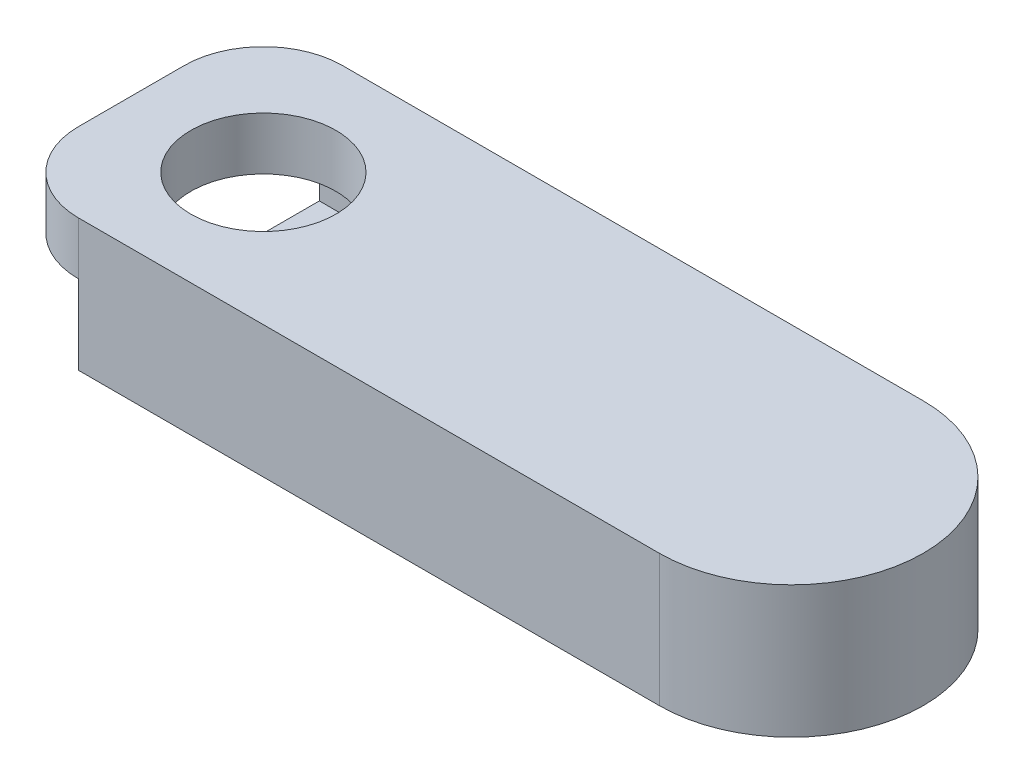
from build123d import *

# Parameters (mm, degrees)
SKETCH1_W           = 381
SKETCH1_H           = 127
BOSS_EXTRUDE1_DEPTH = 25.4
FILLET1_R           = 63.5
FILLET2_R           = 38.1
BOSS_EXTRUDE2_DEPTH = 25.4
BOSS_EXTRUDE3_DEPTH = 12.7
SKETCH11_R          = 34.925
CUT_EXTRUDE4_DEPTH  = 38.1


with BuildPart() as part:
    # Sketch1 → Boss-Extrude1 (new body)
    with BuildSketch(Plane(origin=(0, 0, 0), x_dir=(1, 0, 0), z_dir=(0, 1, 0))):
        with Locations((-190.5, -63.5)):
            Rectangle(SKETCH1_W, SKETCH1_H)
    extrude(amount=BOSS_EXTRUDE1_DEPTH)

    # Fillet1
    fillet1_edges = [part.edges().sort_by_distance(p)[0] for p in [
        (0, 12.7, 0),
        (0, 12.7, 127),
    ]]
    fillet(fillet1_edges, radius=FILLET1_R - 0.0001)  # a hair under: the kernel refuses the full size

    # Fillet2
    fillet2_edges = [part.edges().sort_by_distance(p)[0] for p in [
        (-381, 12.7, 127),
        (-381, 12.7, 0),
    ]]
    fillet(fillet2_edges, radius=FILLET2_R)

    # Sketch2 → Boss-Extrude2 (add)
    with BuildSketch(Plane(origin=(0, 0, 0), x_dir=(1, 0, 0), z_dir=(0, 1, 0))):
        with BuildLine():
            Line((-63.5, -12.7), (-342.9, -11.159231637))
            Line((-342.9, -11.159231637), (-342.9, 0))
            Line((-342.9, 0), (-63.5, 0))
            ThreePointArc((-63.5, 0), (0, -63.5), (-63.5, -127))
            Line((-63.5, -127), (-342.9, -127))
            Line((-342.9, -127), (-342.9, -114.3))
            Line((-342.9, -114.3), (-63.5, -114.3))
            ThreePointArc((-63.5, -114.3), (-12.7, -63.5), (-63.5, -12.7))
        make_face()
    extrude(amount=-BOSS_EXTRUDE2_DEPTH)

    # Sketch3 → Boss-Extrude3 (add)
    with BuildSketch(Plane(origin=(0, -25.4, 0), x_dir=(1, 0, 0), z_dir=(0, 1, 0))):
        with BuildLine():
            Line((-342.9, -127), (-342.9, -82.55))
            Line((-342.9, -82.55), (-63.5, -82.55))
            ThreePointArc((-63.5, -82.55), (-44.45, -63.5), (-63.5, -44.45))
            Line((-63.5, -44.45), (-342.9, -44.45))
            Line((-342.9, -44.45), (-342.9, 0))
            Line((-342.9, 0), (-63.5, 0))
            ThreePointArc((-63.5, 0), (0, -63.5), (-63.5, -127))
            Line((-63.5, -127), (-342.9, -127))
        make_face()
    extrude(amount=-BOSS_EXTRUDE3_DEPTH)

    # Sketch11 → Cut-Extrude4 (cut)
    with BuildSketch(Plane(origin=(0, 25.4, 0), x_dir=(1, 0, 0), z_dir=(0, 1, 0))):
        with Locations(Location((-317.5, -63.5, 0), (0, 0, 270))):
            Circle(SKETCH11_R)
    extrude(amount=-CUT_EXTRUDE4_DEPTH, mode=Mode.SUBTRACT)


solid = part.part
